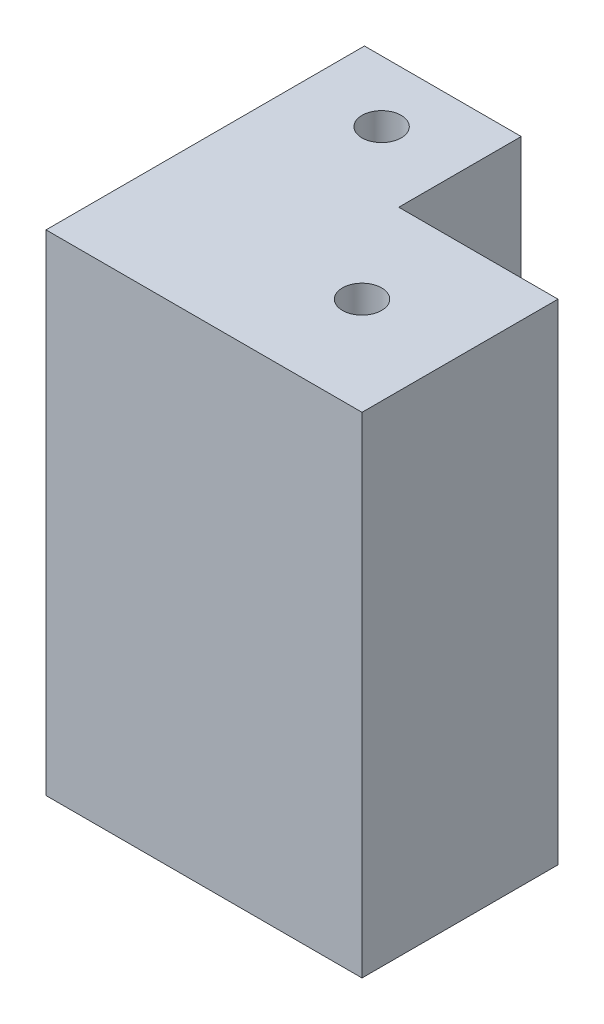
from build123d import *

# Parameters (mm, degrees)
SKETCH1_R                               = 4
BOSS_EXTRUDE1_DEPTH                     = 100
CBORE_FOR_M5_HEX_HEAD_BOLT1_D           = 8
CBORE_FOR_M5_HEX_HEAD_BOLT1_DEPTH       = 30
CBORE_FOR_M5_HEX_HEAD_BOLT1_CBORE_D     = 13.5
CBORE_FOR_M5_HEX_HEAD_BOLT1_CBORE_DEPTH = 23.85
CBORE_FOR_M5_HEX_HEAD_BOLT2_D           = 13.5
CBORE_FOR_M5_HEX_HEAD_BOLT2_DEPTH       = 23.85
CBORE_FOR_M5_HEX_HEAD_BOLT2_CBORE_D     = 32
CBORE_FOR_M5_HEX_HEAD_BOLT2_CBORE_DEPTH = 5
CBORE_FOR_M5_HEX_HEAD_BOLT3_D           = 10.2
CBORE_FOR_M5_HEX_HEAD_BOLT3_DEPTH       = 10
CBORE_FOR_M5_HEX_HEAD_BOLT3_CBORE_D     = 22
CBORE_FOR_M5_HEX_HEAD_BOLT3_CBORE_DEPTH = 3.5


with BuildPart() as part:
    # Sketch1 → Boss-Extrude1 (new body)
    with BuildSketch(Plane(origin=(0, 0, 0), x_dir=(1, 0, 0), z_dir=(0, 1, 0))):
        Polygon((0, 0), (0, 25), (-32, 25), (-32, -40), (32.5, -40), (32.5, 0), align=None)
        with Locations((-16, 12.5)):
            Circle(SKETCH1_R, mode=Mode.SUBTRACT)
        with Locations((12.5, -20)):
            Circle(SKETCH1_R, mode=Mode.SUBTRACT)
    extrude(amount=BOSS_EXTRUDE1_DEPTH)

    # CBORE for M5 Hex Head Bolt1
    with Locations(Plane(origin=(0, 0, 0), x_dir=(-1, 0, 0), z_dir=(0, -1, 0))):
        with Locations((-12.5, -20)):
            CounterBoreHole(CBORE_FOR_M5_HEX_HEAD_BOLT1_D / 2, CBORE_FOR_M5_HEX_HEAD_BOLT1_CBORE_D / 2, CBORE_FOR_M5_HEX_HEAD_BOLT1_CBORE_DEPTH, depth=CBORE_FOR_M5_HEX_HEAD_BOLT1_DEPTH)

    # CBORE for M5 Hex Head Bolt2
    with Locations(Plane(origin=(0, 0, 0), x_dir=(-1, 0, 0), z_dir=(0, -1, 0))):
        with Locations((-12.5, -20)):
            CounterBoreHole(CBORE_FOR_M5_HEX_HEAD_BOLT2_D / 2, CBORE_FOR_M5_HEX_HEAD_BOLT2_CBORE_D / 2, CBORE_FOR_M5_HEX_HEAD_BOLT2_CBORE_DEPTH, depth=CBORE_FOR_M5_HEX_HEAD_BOLT2_DEPTH)

    # CBORE for M5 Hex Head Bolt3
    with Locations(Plane(origin=(0, 0, 0), x_dir=(-1, 0, 0), z_dir=(0, -1, 0))):
        with Locations((16, 12.5)):
            CounterBoreHole(CBORE_FOR_M5_HEX_HEAD_BOLT3_D / 2, CBORE_FOR_M5_HEX_HEAD_BOLT3_CBORE_D / 2, CBORE_FOR_M5_HEX_HEAD_BOLT3_CBORE_DEPTH, depth=CBORE_FOR_M5_HEX_HEAD_BOLT3_DEPTH)


solid = part.part
